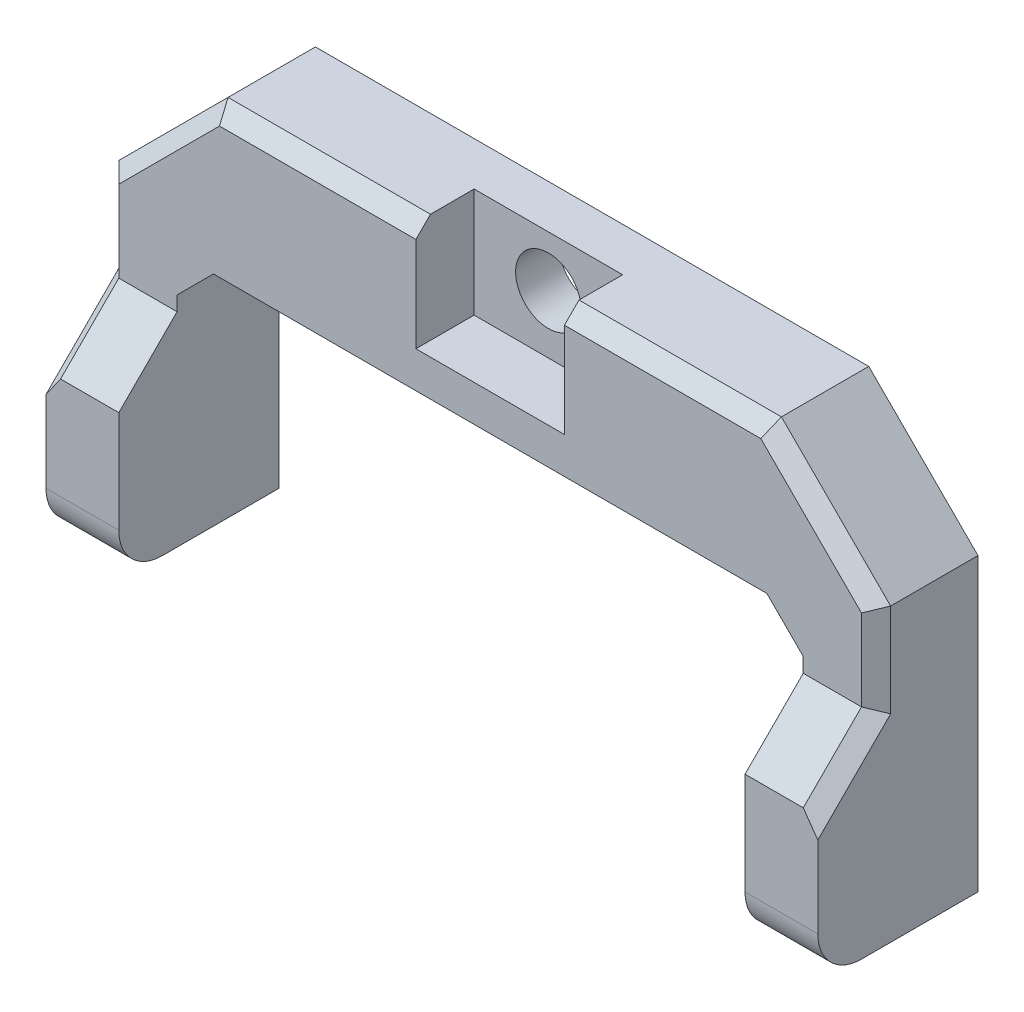
from build123d import *

# Parameters (mm, degrees)
BOSS_EXTRUDE1_DEPTH  = 7
SKETCH6_W            = 5
SKETCH6_H            = 10
BOSS_EXTRUDE2_DEPTH  = 4
SKETCH3_W            = 5.1
SKETCH3_H            = 7.5
CUT_EXTRUDE1_DEPTH   = 4
M4_CLEARANCE_HOLE1_D = 4.5
CHAMFER2_SIZE        = 4
FILLET2_R            = 3


# Some blends are built 0.0001 mm under size
with BuildPart() as part:
    # Sketch1 → Boss-Extrude1 (new body)
    with BuildSketch(Plane.XY):
        Polygon((0, 0), (0, -10), (-19, -10), (-21.5, -12.5), (-21.5, -27.5), (-26.5, -27.5), (-26.5, -7.5), (-19, 0), align=None)
    boss_extrude1 = extrude(amount=BOSS_EXTRUDE1_DEPTH)

    # Sketch6 → Boss-Extrude2 (add)
    with BuildSketch(Plane.XY.offset(7)):
        with Locations((-24, -22.5)):
            Rectangle(SKETCH6_W, SKETCH6_H)
    boss_extrude2 = extrude(amount=BOSS_EXTRUDE2_DEPTH)

    # Sketch3 → Cut-Extrude1 (cut)
    with BuildSketch(Plane.XY.offset(7)):
        with Locations((-2.55, -3.75)):
            Rectangle(SKETCH3_W, SKETCH3_H)
    cut_extrude1 = extrude(amount=-CUT_EXTRUDE1_DEPTH, mode=Mode.SUBTRACT)

    # Mirror1: Boss-Extrude1, Boss-Extrude2, Cut-Extrude1 across plane
    add(boss_extrude1.mirror(Plane(origin=(0, 0, 7), x_dir=(0, 0, 1), z_dir=(-1, 0, 0))))
    add(boss_extrude2.mirror(Plane(origin=(0, 0, 7), x_dir=(0, 0, 1), z_dir=(-1, 0, 0))))
    add(cut_extrude1.mirror(Plane(origin=(0, 0, 7), x_dir=(0, 0, 1), z_dir=(-1, 0, 0))), mode=Mode.SUBTRACT)

    # M4 Clearance Hole1 (through all)
    with Locations(Plane.XY.offset(3)):
        with Locations((0, -3.5)):
            Hole(M4_CLEARANCE_HOLE1_D / 2)

    # Chamfer2
    chamfer2_edges = [part.edges().sort_by_distance(p)[0] for p in [
        (-24, -17.5, 7),
        (24, -17.5, 7),
    ]]
    chamfer(chamfer2_edges, length=CHAMFER2_SIZE - 0.0001)  # a hair under: the kernel refuses the full size

    # Chamfer4
    # the kernel refuses this chamfer: 1 mm, written as the material it takes off along each edge
    with BuildSketch(Plane(origin=(26.5, -11.68164552, 5.18154552), x_dir=(-0.9996219169112968, 0.019442520806014118, 0.01944252080601436), z_dir=(0, -0.7071067811865476, 0.7071067811865476))) as chamfer4_piece_1_section:
        with BuildLine():
            Line((1.028673195, 0), (-0.056547155, 1.027117794))
            Line((-0.056547155, 1.027117794), (-0.076539593, 1.026567876))
            ThreePointArc((-0.076539593, 1.026567876), (-0.034129227, 0.51339783), (-0.019992438, -0.000549918))
            Line((-0.019992438, -0.000549918), (0.000549918, -0.019992438))
            ThreePointArc((0.000549918, -0.019992438), (0.514497665, -0.00585565), (1.029223113, -0.019992438))
            Line((1.029223113, -0.019992438), (1.028673195, 0))
        make_face()
    chamfer4_piece_1 = extrude(amount=10.800078804, mode=Mode.PRIVATE)
    chamfer4_piece_1 = split(chamfer4_piece_1, bisect_by=Plane(origin=(26.156619069, -15.715277747, 7), z_dir=(0, 0, 1)), keep=Keep.TOP, mode=Mode.PRIVATE)
    add(chamfer4_piece_1, mode=Mode.SUBTRACT)
    with BuildSketch(Plane(origin=(-26.5, -11.68164552, 5.18154552), x_dir=(0.9996219169112968, 0.019442520806013806, 0.019442520806013806), z_dir=(0, -0.7071067811865476, 0.7071067811865476))) as chamfer4_piece_2_section:
        with BuildLine():
            Line((1.028673195, 0), (-0.056547155, -1.027117794))
            Line((-0.056547155, -1.027117794), (-0.076539593, -1.026567876))
            ThreePointArc((-0.076539593, -1.026567876), (-0.034129227, -0.51339783), (-0.019992438, 0.000549918))
            Line((-0.019992438, 0.000549918), (0.000549918, 0.019992438))
            ThreePointArc((0.000549918, 0.019992438), (0.514497665, 0.00585565), (1.029223113, 0.019992438))
            Line((1.029223113, 0.019992438), (1.028673195, 0))
        make_face()
    chamfer4_piece_2 = extrude(amount=10.800078804, mode=Mode.PRIVATE)
    chamfer4_piece_2 = split(chamfer4_piece_2, bisect_by=Plane(origin=(-26.156619069, -15.715277747, 7), z_dir=(0, 0, 1)), keep=Keep.TOP, mode=Mode.PRIVATE)
    add(chamfer4_piece_2, mode=Mode.SUBTRACT)
    with BuildSketch(Plane(origin=(-28.31845448, -9.31845448, 7), x_dir=(0.7068394360706726, -0.7068394360706746, 0.027495876610586528), z_dir=(0.7071067811865485, 0.7071067811865466, 0))) as chamfer4_piece_3:
        with BuildLine():
            Line((1.028673195, 0), (-0.056547155, 1.027117794))
            Line((-0.056547155, 1.027117794), (-0.076539593, 1.026567876))
            ThreePointArc((-0.076539593, 1.026567876), (-0.034129227, 0.51339783), (-0.019992438, -0.000549918))
            Line((-0.019992438, -0.000549918), (0.000549918, -0.019992438))
            ThreePointArc((0.000549918, -0.019992438), (0.514497665, -0.00585565), (1.029223113, -0.019992438))
            Line((1.029223113, -0.019992438), (1.028673195, 0))
        make_face()
    extrude(amount=15.749967694, mode=Mode.SUBTRACT)
    with BuildSketch(Plane(origin=(-26.5, -16.071782988, 7), x_dir=(0.9996219169112968, 0, 0.02749587661058651), z_dir=(0, 1, 0))) as chamfer4_piece_4_section:
        with BuildLine():
            Line((1.028673195, 0), (-0.056547155, 1.027117794))
            Line((-0.056547155, 1.027117794), (-0.076539593, 1.026567876))
            ThreePointArc((-0.076539593, 1.026567876), (-0.034129227, 0.51339783), (-0.019992438, -0.000549918))
            Line((-0.019992438, -0.000549918), (0.000549918, -0.019992438))
            ThreePointArc((0.000549918, -0.019992438), (0.514497665, -0.00585565), (1.029223113, -0.019992438))
            Line((1.029223113, -0.019992438), (1.028673195, 0))
        make_face()
    chamfer4_piece_4 = extrude(amount=11.143465976, mode=Mode.PRIVATE)
    chamfer4_piece_4 = split(chamfer4_piece_4, bisect_by=Plane(origin=(-26.166087376, -11.115587602, 4.615487602), z_dir=(0, 0.7071067811865476, 0.7071067811865476)), keep=Keep.TOP, mode=Mode.PRIVATE)
    add(chamfer4_piece_4, mode=Mode.SUBTRACT)
    with BuildSketch(Plane(origin=(-21.571682988, 0, 7), x_dir=(0, -0.9996219169112968, 0.027495876610586494), z_dir=(1, 0, 0))) as chamfer4_piece_5:
        with BuildLine():
            Line((1.028673195, 0), (-0.056547155, 1.027117794))
            Line((-0.056547155, 1.027117794), (-0.076539593, 1.026567876))
            ThreePointArc((-0.076539593, 1.026567876), (-0.034129227, 0.51339783), (-0.019992438, -0.000549918))
            Line((-0.019992438, -0.000549918), (0.000549918, -0.019992438))
            ThreePointArc((0.000549918, -0.019992438), (0.514497665, -0.00585565), (1.029223113, -0.019992438))
            Line((1.029223113, -0.019992438), (1.028673195, 0))
        make_face()
    extrude(amount=19.043365976, mode=Mode.SUBTRACT)
    with BuildSketch(Plane(origin=(26.5, -16.071782988, 7), x_dir=(-0.9996219169112968, 0, 0.02749587661058651), z_dir=(0, 1, 0))) as chamfer4_piece_6_section:
        with BuildLine():
            Line((1.028673195, 0), (-0.056547155, -1.027117794))
            Line((-0.056547155, -1.027117794), (-0.076539593, -1.026567876))
            ThreePointArc((-0.076539593, -1.026567876), (-0.034129227, -0.51339783), (-0.019992438, 0.000549918))
            Line((-0.019992438, 0.000549918), (0.000549918, 0.019992438))
            ThreePointArc((0.000549918, 0.019992438), (0.514497665, 0.00585565), (1.029223113, 0.019992438))
            Line((1.029223113, 0.019992438), (1.028673195, 0))
        make_face()
    chamfer4_piece_6 = extrude(amount=11.143465976, mode=Mode.PRIVATE)
    chamfer4_piece_6 = split(chamfer4_piece_6, bisect_by=Plane(origin=(26.166087376, -11.115587602, 4.615487602), z_dir=(0, 0.7071067811865476, 0.7071067811865476)), keep=Keep.TOP, mode=Mode.PRIVATE)
    add(chamfer4_piece_6, mode=Mode.SUBTRACT)
    with BuildSketch(Plane(origin=(28.31845448, -9.31845448, 7), x_dir=(-0.7068394360706725, -0.7068394360706747, 0.027495876610586528), z_dir=(-0.7071067811865487, 0.7071067811865464, 0))) as chamfer4_piece_7:
        with BuildLine():
            Line((1.028673195, 0), (-0.056547155, -1.027117794))
            Line((-0.056547155, -1.027117794), (-0.076539593, -1.026567876))
            ThreePointArc((-0.076539593, -1.026567876), (-0.034129227, -0.51339783), (-0.019992438, 0.000549918))
            Line((-0.019992438, 0.000549918), (0.000549918, 0.019992438))
            ThreePointArc((0.000549918, 0.019992438), (0.514497665, 0.00585565), (1.029223113, 0.019992438))
            Line((1.029223113, 0.019992438), (1.028673195, 0))
        make_face()
    extrude(amount=15.749967694, mode=Mode.SUBTRACT)
    with BuildSketch(Plane(origin=(21.571682988, 0, 7), x_dir=(0, -0.9996219169112968, 0.027495876610586494), z_dir=(-1, 0, 0))) as chamfer4_piece_8:
        with BuildLine():
            Line((1.028673195, 0), (-0.056547155, -1.027117794))
            Line((-0.056547155, -1.027117794), (-0.076539593, -1.026567876))
            ThreePointArc((-0.076539593, -1.026567876), (-0.034129227, -0.51339783), (-0.019992438, 0.000549918))
            Line((-0.019992438, 0.000549918), (0.000549918, 0.019992438))
            ThreePointArc((0.000549918, 0.019992438), (0.514497665, 0.00585565), (1.029223113, 0.019992438))
            Line((1.029223113, 0.019992438), (1.028673195, 0))
        make_face()
    extrude(amount=19.043365976, mode=Mode.SUBTRACT)
    with BuildSketch(Plane(origin=(26.5, -16.071782988, 7), x_dir=(-0.9996219169112968, 0, 0.02749587661058651), z_dir=(0, 1, 0))) as chamfer4_piece_9a_section:
        with BuildLine():
            Line((1.028673195, 0), (-0.056547155, -1.027117794))
            Line((-0.056547155, -1.027117794), (-0.076539593, -1.026567876))
            ThreePointArc((-0.076539593, -1.026567876), (-0.034129227, -0.51339783), (-0.019992438, 0.000549918))
            Line((-0.019992438, 0.000549918), (0.000549918, 0.019992438))
            ThreePointArc((0.000549918, 0.019992438), (0.514497665, 0.00585565), (1.029223113, 0.019992438))
            Line((1.029223113, 0.019992438), (1.028673195, 0))
        make_face()
    chamfer4_piece_9a = extrude(amount=11.143465976, mode=Mode.PRIVATE)
    chamfer4_piece_9a = split(chamfer4_piece_9a, bisect_by=Plane(origin=(26.181906875, -13.879260813, 7.379160813), z_dir=(0, -0.7071067811865476, -0.7071067811865476)), keep=Keep.TOP, mode=Mode.PRIVATE)
    with BuildSketch(Plane(origin=(26.5, -11.68164552, 5.18154552), x_dir=(-0.9996219169112968, 0.019442520806014118, 0.01944252080601436), z_dir=(0, -0.7071067811865476, 0.7071067811865476))) as chamfer4_piece_9b_section:
        with BuildLine():
            Line((1.028673195, 0), (-0.056547155, 1.027117794))
            Line((-0.056547155, 1.027117794), (-0.076539593, 1.026567876))
            ThreePointArc((-0.076539593, 1.026567876), (-0.034129227, 0.51339783), (-0.019992438, -0.000549918))
            Line((-0.019992438, -0.000549918), (0.000549918, -0.019992438))
            ThreePointArc((0.000549918, -0.019992438), (0.514497665, -0.00585565), (1.029223113, -0.019992438))
            Line((1.029223113, -0.019992438), (1.028673195, 0))
        make_face()
    chamfer4_piece_9b = extrude(amount=10.800078804, mode=Mode.PRIVATE)
    chamfer4_piece_9b = split(chamfer4_piece_9b, bisect_by=Plane(origin=(26.181906875, -12.963885635, 7), z_dir=(0, 0, -1)), keep=Keep.TOP, mode=Mode.PRIVATE)
    chamfer4_piece_9 = chamfer4_piece_9a & chamfer4_piece_9b
    add(chamfer4_piece_9, mode=Mode.SUBTRACT)
    with BuildSketch(Plane(origin=(-26.5, -16.071782988, 7), x_dir=(0.9996219169112968, 0, 0.02749587661058651), z_dir=(0, 1, 0))) as chamfer4_piece_10a_section:
        with BuildLine():
            Line((1.028673195, 0), (-0.056547155, 1.027117794))
            Line((-0.056547155, 1.027117794), (-0.076539593, 1.026567876))
            ThreePointArc((-0.076539593, 1.026567876), (-0.034129227, 0.51339783), (-0.019992438, -0.000549918))
            Line((-0.019992438, -0.000549918), (0.000549918, -0.019992438))
            ThreePointArc((0.000549918, -0.019992438), (0.514497665, -0.00585565), (1.029223113, -0.019992438))
            Line((1.029223113, -0.019992438), (1.028673195, 0))
        make_face()
    chamfer4_piece_10a = extrude(amount=11.143465976, mode=Mode.PRIVATE)
    chamfer4_piece_10a = split(chamfer4_piece_10a, bisect_by=Plane(origin=(-26.181906875, -13.879260813, 7.379160813), z_dir=(0, -0.7071067811865476, -0.7071067811865476)), keep=Keep.TOP, mode=Mode.PRIVATE)
    with BuildSketch(Plane(origin=(-26.5, -11.68164552, 5.18154552), x_dir=(0.9996219169112968, 0.019442520806013806, 0.019442520806013806), z_dir=(0, -0.7071067811865476, 0.7071067811865476))) as chamfer4_piece_10b_section:
        with BuildLine():
            Line((1.028673195, 0), (-0.056547155, -1.027117794))
            Line((-0.056547155, -1.027117794), (-0.076539593, -1.026567876))
            ThreePointArc((-0.076539593, -1.026567876), (-0.034129227, -0.51339783), (-0.019992438, 0.000549918))
            Line((-0.019992438, 0.000549918), (0.000549918, 0.019992438))
            ThreePointArc((0.000549918, 0.019992438), (0.514497665, 0.00585565), (1.029223113, 0.019992438))
            Line((1.029223113, 0.019992438), (1.028673195, 0))
        make_face()
    chamfer4_piece_10b = extrude(amount=10.800078804, mode=Mode.PRIVATE)
    chamfer4_piece_10b = split(chamfer4_piece_10b, bisect_by=Plane(origin=(-26.181906875, -12.963885635, 7), z_dir=(0, 0, -1)), keep=Keep.TOP, mode=Mode.PRIVATE)
    chamfer4_piece_10 = chamfer4_piece_10a & chamfer4_piece_10b
    add(chamfer4_piece_10, mode=Mode.SUBTRACT)

    # Fillet2
    fillet2_edges = [part.edges().sort_by_distance(p)[0] for p in [
        (-24, -27.5, 11),
        (24, -27.5, 11),
    ]]
    fillet(fillet2_edges, radius=FILLET2_R)


solid = part.part
